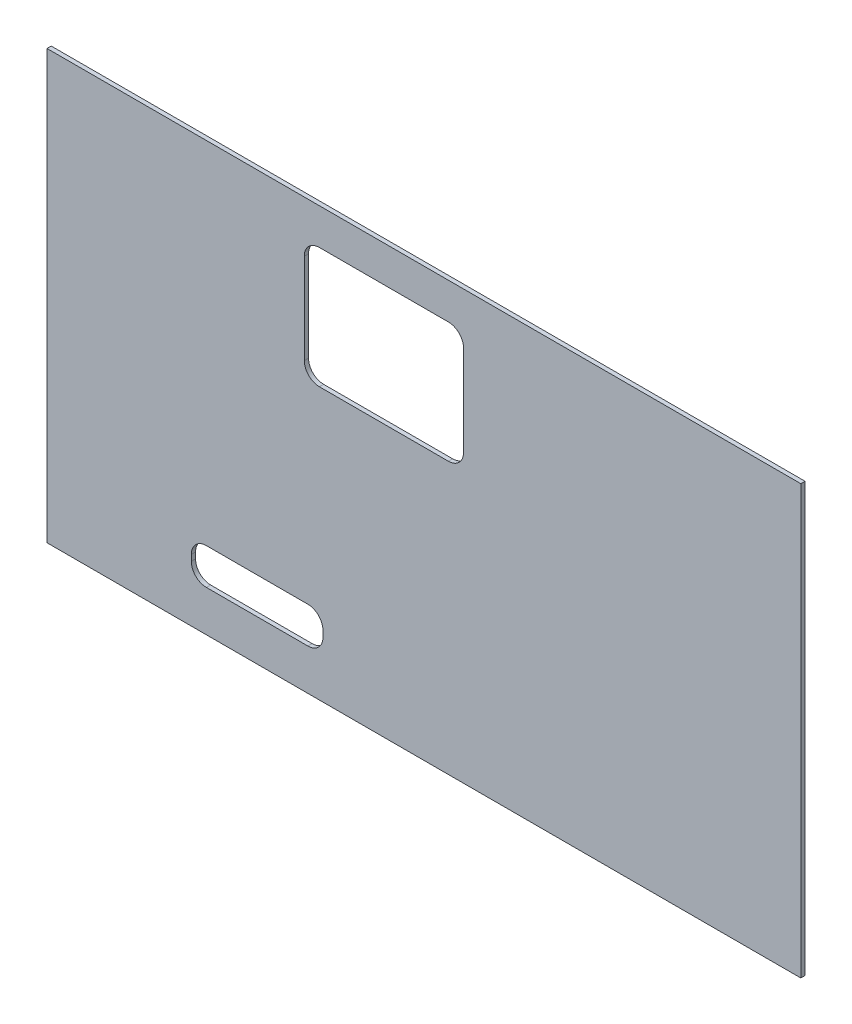
from build123d import *

# Parameters (mm, degrees)
SKETCH2_W           = 21.826709
SKETCH2_H           = 6
SKETCH2_W_2         = 26.410128
SKETCH2_H_2         = 20
BOSS_EXTRUDE5_DEPTH = 0.7
BOSS_EXTRUDE6_DEPTH = 5
FILLET1_R           = 2.5


with BuildPart() as part:
    # Sketch2 → Boss-Extrude5 (new body)
    with BuildSketch(Plane.XY):
        Polygon((0, 0), (0, -71), (16.75, -71), (125.022768, -71), (125.022768, 0), align=None)
        with Locations((34.8557935, -61.193169)):
            Rectangle(SKETCH2_W, SKETCH2_H, mode=Mode.SUBTRACT)
        with Locations((55.882521, -16)):
            Rectangle(SKETCH2_W_2, SKETCH2_H_2, mode=Mode.SUBTRACT)
    extrude(amount=BOSS_EXTRUDE5_DEPTH)

    # Sketch2<9> → Boss-Extrude6 (add)
    with BuildSketch(Plane.XY):
        Polygon((113.058624, -23.434), (113.058624, -33.55), (119.968624, -16.966), (119.968624, -6.85), align=None)
        Polygon((100.308624, -6.85), (100.308624, -16.966), (107.218624, -33.55), (107.218624, -23.434), align=None)
        Polygon((114.883624, -6.17), (105.393624, -6.17), (110.138624, -17.558), align=None)
        Polygon((18.745, -6.17), (9.255, -6.17), (14, -17.558), align=None)
        Polygon((11.08, -23.434), (4.17, -6.85), (4.17, -16.966), (11.08, -33.55), align=None)
        Polygon((23.83, -16.966), (23.83, -6.85), (16.92, -23.434), (16.92, -33.55), align=None)
    extrude(amount=-BOSS_EXTRUDE6_DEPTH)

    # Fillet1
    fillet1_edges = [part.edges().sort_by_distance(p)[0] for p in [
        (23.942439, -64.193169, 0.35),
        (45.769148, -64.193169, 0.35),
        (45.769148, -58.193169, 0.35),
        (23.942439, -58.193169, 0.35),
        (42.677457, -6, 0.35),
        (69.087585, -6, 0.35),
        (42.677457, -26, 0.35),
        (69.087585, -26, 0.35),
    ]]
    fillet(fillet1_edges, radius=FILLET1_R)


solid = part.part
